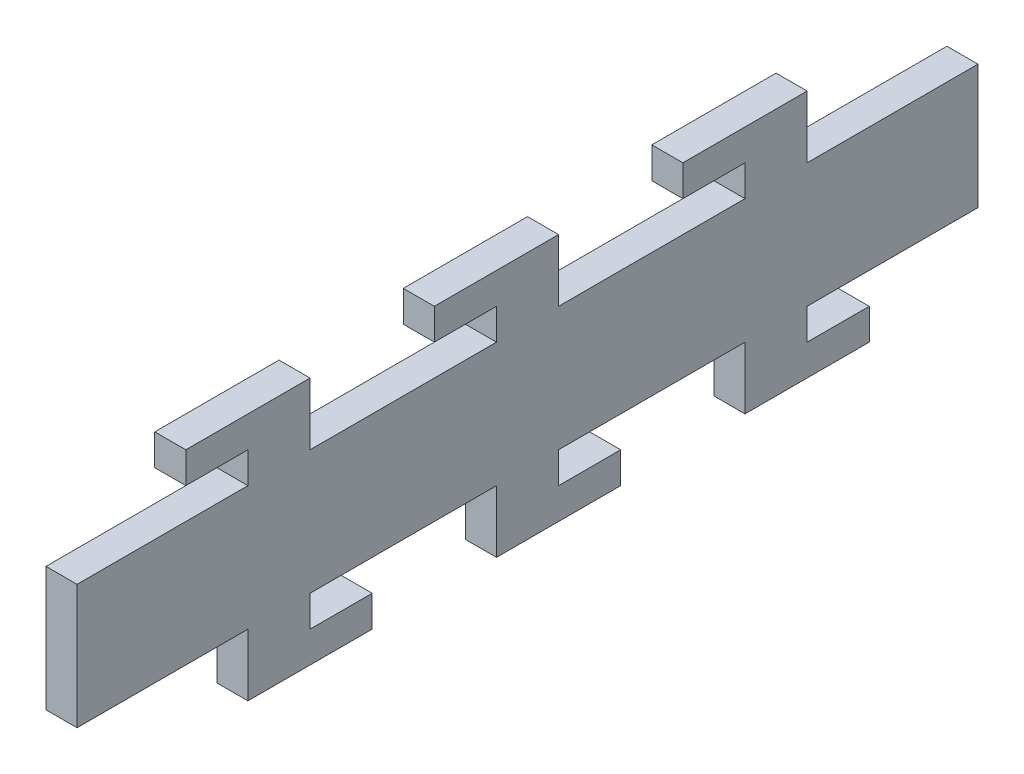
from build123d import *

# Parameters (mm, degrees)
BOSS_EXTRU_1_DEPTH = 5


with BuildPart() as part:
    # Esquisse1 → Boss.-Extru.1 (new body)
    with BuildSketch(Plane(origin=(0, 0, 0), x_dir=(0, 0, -1), z_dir=(1, 0, 0))):
        Polygon((72.5, -10), (45, -10), (45, -15), (55, -15), (55, -20), (35, -20), (35, -10), (5, -10), (5, -15), (15, -15), (15, -20), (-5, -20), (-5, -10), (-35, -10), (-35, -15), (-25, -15), (-25, -20), (-45, -20), (-45, -10), (-72.5, -10), (-72.5, 10), (-45, 10), (-45, 15), (-55, 15), (-55, 20), (-35, 20), (-35, 10), (-5, 10), (-5, 15), (-15, 15), (-15, 20), (5, 20), (5, 10), (35, 10), (35, 15), (25, 15), (25, 20), (45, 20), (45, 10), (72.5, 10), align=None)
    extrude(amount=BOSS_EXTRU_1_DEPTH)


solid = part.part
